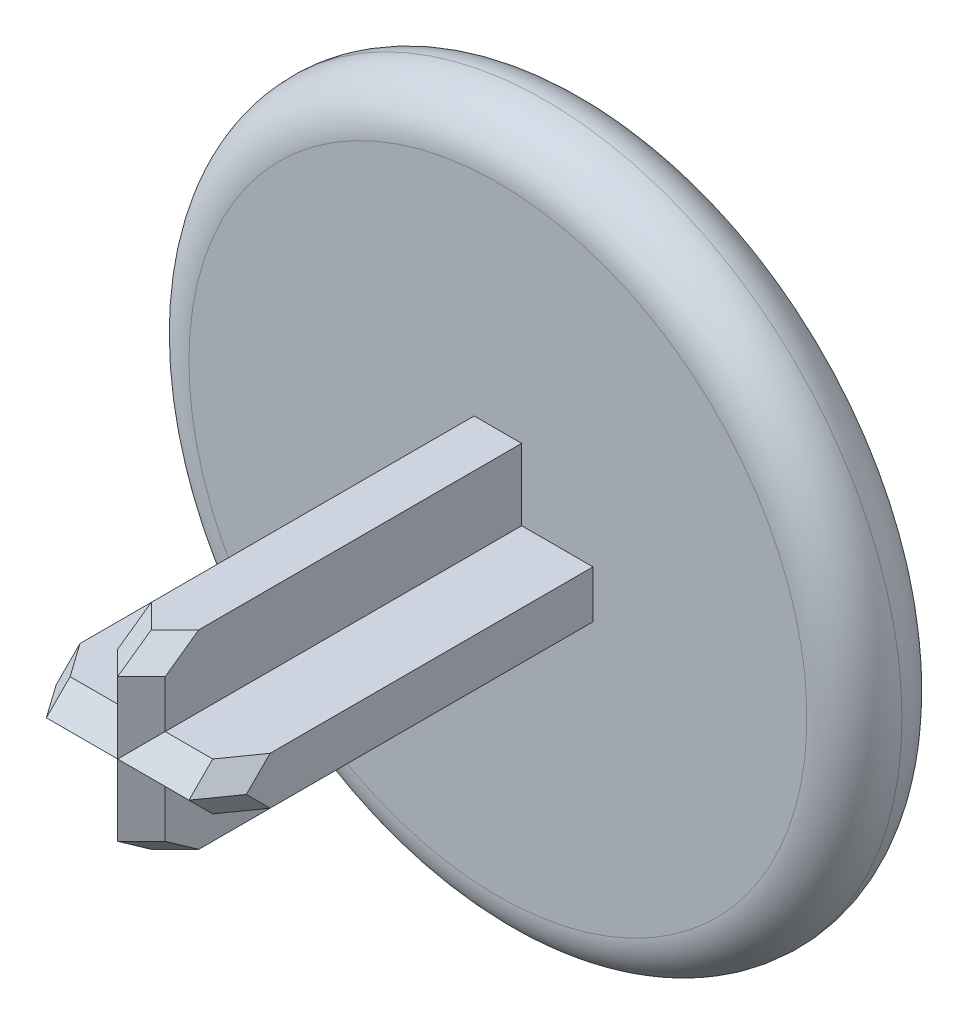
from build123d import *

# Parameters (mm, degrees)
SKETCH_1_W      = 4
SKETCH_1_H      = 1
SKETCH_1_W_2    = 1
SKETCH_1_H_2    = 4
EXTRUDE_1_DEPTH = 8
CHAMFER_1_SIZE  = 0.5
CHAMFER_2_SIZE  = 0.5
SKETCH_2_R      = 7.5
EXTRUDE_2_DEPTH = 2
FILLET_1_R      = 1


# Some blends are built 0.0001 mm under size
with BuildPart() as part:
    # 草图1 → 凸台-拉伸1 (new body)
    with BuildSketch(Plane.XY):
        Rectangle(SKETCH_1_W, SKETCH_1_H)
        Rectangle(SKETCH_1_W_2, SKETCH_1_H_2)
    extrude(amount=EXTRUDE_1_DEPTH)

    # 倒角1
    chamfer_1_edges = [part.edges().sort_by_distance(p)[0] for p in [
        (-1.25, -0.5, 8),
        (-0.5, -1.25, 8),
        (0.5, -1.25, 8),
        (1.25, -0.5, 8),
        (-1.25, 0.5, 8),
        (-0.5, 1.25, 8),
        (1.25, 0.5, 8),
        (0.5, 1.25, 8),
    ]]
    chamfer(chamfer_1_edges, length=CHAMFER_1_SIZE - 0.0001)  # a hair under: the kernel refuses the full size

    # 倒角2
    # the kernel refuses this chamfer: 0.5 mm, written as the material it takes off along each edge
    with BuildSketch(Plane(origin=(-2, 1.40922724, 6.59087276), x_dir=(0.9996219169112968, 0.01944252080601401, 0.019442520806014003), z_dir=(0, -0.7071067811865474, 0.7071067811865477)), Plane(origin=(0.90912724, -2, 8.90922724), x_dir=(0.7068394360706737, -0.02749587661058652, -0.7068394360706732), z_dir=(-0.7071067811865474, 0, -0.7071067811865477)), Plane(origin=(2, 0.90912724, 8.90922724), x_dir=(0.027495876610586514, 0.7068394360706736, -0.7068394360706733), z_dir=(0, -0.7071067811865474, -0.7071067811865477)), Plane(origin=(-0.90912724, 2, 8.90922724), x_dir=(-0.7068394360706737, 0.02749587661058652, -0.7068394360706732), z_dir=(0.7071067811865474, 0, -0.7071067811865477)), Plane(origin=(-1.40922724, 2, 6.59087276), x_dir=(0.7068394360706737, 0.027495876610586494, -0.7068394360706733), z_dir=(0.7071067811865474, 0, 0.7071067811865477))) as chamfer_2_piece_1:
        Polygon((CHAMFER_2_SIZE * 0.999621916911, -CHAMFER_2_SIZE * 0.0274958766106), (-CHAMFER_2_SIZE * 0.0274958766106, -CHAMFER_2_SIZE * 0.999621916911), (0, 0), align=None)
    extrude(amount=3.278648348, mode=Mode.SUBTRACT)
    with BuildSketch(Plane(origin=(-2, 0.90912724, 8.90922724), x_dir=(-0.027495876610586514, 0.7068394360706736, -0.7068394360706733), z_dir=(0, -0.7071067811865474, -0.7071067811865477)), Plane(origin=(-0.90912724, -2, 8.90922724), x_dir=(-0.7068394360706737, -0.02749587661058652, -0.7068394360706732), z_dir=(0.7071067811865474, 0, -0.7071067811865477)), Plane(origin=(2, -0.90912724, 8.90922724), x_dir=(0.027495876610586514, -0.7068394360706736, -0.7068394360706733), z_dir=(0, 0.7071067811865474, -0.7071067811865477))) as chamfer_2_piece_2:
        Polygon((CHAMFER_2_SIZE * 0.999621916911, CHAMFER_2_SIZE * 0.0274958766106), (-CHAMFER_2_SIZE * 0.0274958766106, CHAMFER_2_SIZE * 0.999621916911), (0, 0), align=None)
    extrude(amount=3.278648348, mode=Mode.SUBTRACT)

    # 草图2 → 凸台-拉伸2 (add)
    with BuildSketch(Plane(origin=(0, 0, 0), x_dir=(-1, 0, 0), z_dir=(0, 0, -1))):
        Circle(SKETCH_2_R)
    extrude(amount=EXTRUDE_2_DEPTH)

    # 圆角1
    fillet_1_edges = [part.edges().sort_by_distance(p)[0] for p in [
        (7.5, 0, 0),
        (7.5, 0, -2),
    ]]
    fillet(fillet_1_edges, radius=FILLET_1_R - 0.0001)  # a hair under: the kernel refuses the full size


solid = part.part
